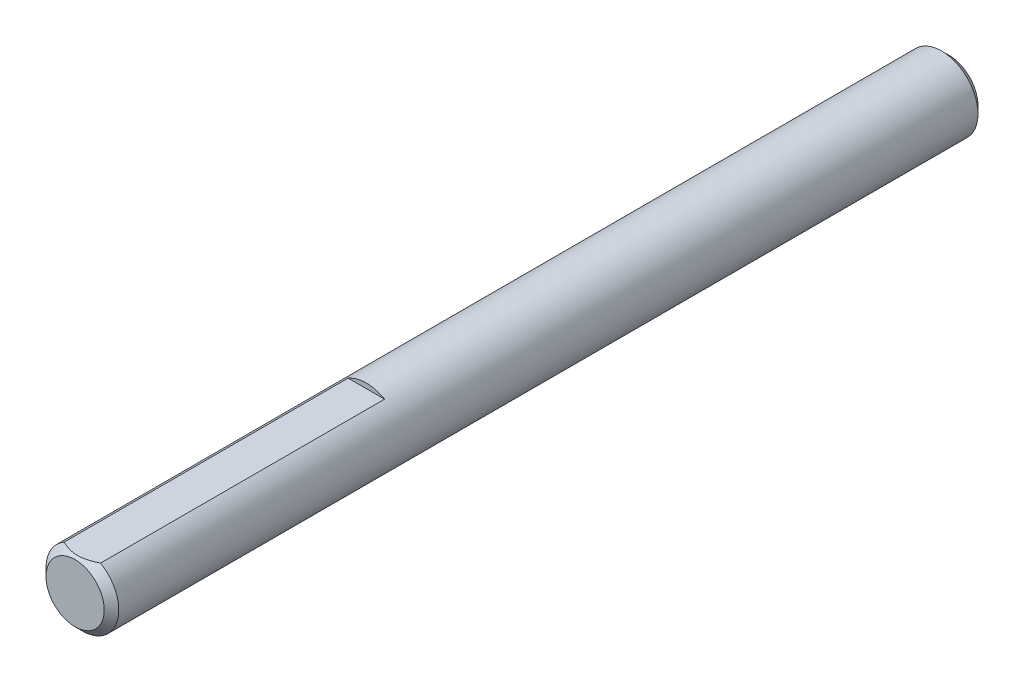
from build123d import *

# Parameters (mm, degrees)
SKETCH1_R      = 3.175
EXTRUDE1_DEPTH = 38.1
CHAMFER1_SIZE  = 0.635
EXTRUDE7_DEPTH = 51.998051433


with BuildPart() as part:
    # Sketch1 → Extrude1 (new, symmetric)
    with BuildSketch(Plane.XY):
        Circle(SKETCH1_R)
    extrude(amount=EXTRUDE1_DEPTH, both=True)

    # Chamfer1
    chamfer1_edges = [part.edges().sort_by_distance(p)[0] for p in [
        (-3.175, 0, -38.1),
        (-3.175, 0, 38.1),
    ]]
    chamfer(chamfer1_edges, length=CHAMFER1_SIZE)

    # Sketch13 → Extrude7 (cut, through all)
    with BuildSketch(Plane.XY.offset(12.7)):
        with BuildLine():
            Line((-1.5875, 2.749630657), (1.5875, 2.749630657))
            ThreePointArc((1.5875, 2.749630657), (0, 3.175), (-1.5875, 2.749630657))
        make_face()
    extrude(amount=EXTRUDE7_DEPTH, mode=Mode.SUBTRACT)


solid = part.part
